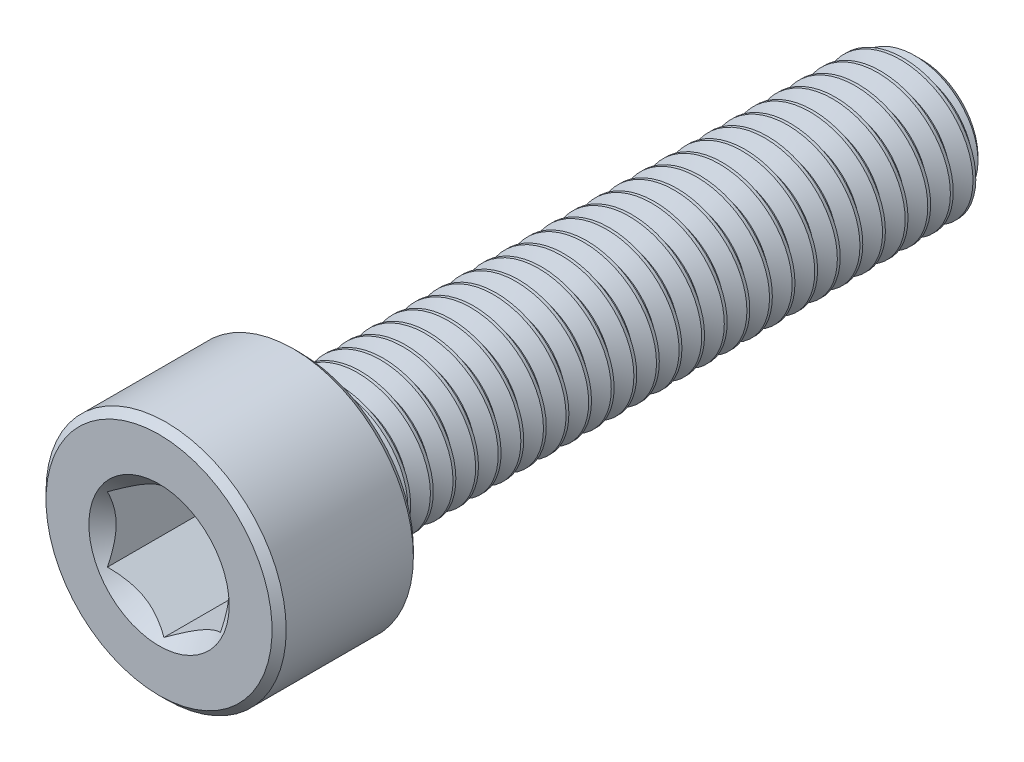
from build123d import *

# Parameters (mm, degrees)
CUT_EXTRUDE1_DEPTH     = 4
SPLIT1_SURFACE_1_BACK  = 30.555
SPLIT1_SURFACE_1_DEPTH = 61.11
SPLIT1_SURFACE_2_BACK  = 30.555
SPLIT1_SURFACE_2_DEPTH = 61.11
CUT_SWEEP1_PITCH       = 0.8


with BuildPart() as part:
    # Sketch2 → Revolve1 (revolve)
    with BuildSketch(Plane(origin=(0, 0, 0), x_dir=(0, 0, -1), z_dir=(1, 0, 0))):
        with BuildLine():
            Line((-13.5, 0), (-13.5, 4))
            Line((-13.5, 4), (-13.25, 4.25))
            Line((-13.25, 4.25), (-8.75, 4.25))
            Line((-8.75, 4.25), (-8.5, 4))
            Line((-8.5, 4), (-8.5, 2.75))
            ThreePointArc((-8.5, 2.75), (-8.426776695, 2.573223305), (-8.25, 2.5))
            Line((-8.25, 2.5), (12.980384758, 2.5))
            Line((12.980384758, 2.5), (13.5, 1.980384758))
            Line((13.5, 1.980384758), (13.5, 0))
            Line((13.5, 0), (-13.5, 0))
        make_face()
    revolve(axis=Axis((0, 0, -13.5), (0, 0, 1)))

    # Sketch3 → Cut-Extrude1 (cut)
    with BuildSketch(Plane.XY.offset(13.5)):
        Polygon((2, -1.154700538), (2, 1.154700538), (0, 2.309401077), (-2, 1.154700538), (-2, -1.154700538), (0, -2.309401077), align=None)
    extrude(amount=-CUT_EXTRUDE1_DEPTH, mode=Mode.SUBTRACT)

    # Cut-Extrude2 cone 1 section (through the dimple's axis) → Cut-Extrude2 (revolve, cut)
    with BuildSketch(Plane(origin=(0, 0, 13.5), x_dir=(0, -1, 0), z_dir=(1, 0, 0))):
        Polygon((0, 0), (2.482606158, 0), (0, 2.482606158), align=None)
    revolve(axis=Axis((0, 0, 13.5), (0, 0, -1)), mode=Mode.SUBTRACT)


with BuildPart() as body_2:
    # Split1: the piece behind the surface
    add(part.part)
    # Split1 surface: a surface, the sketch's curves swept straight by 61.11 mm
    with BuildLine(Plane(origin=(0, 0, 0), x_dir=(0, 0, -1), z_dir=(1, 0, 0)).offset(-SPLIT1_SURFACE_1_BACK), mode=Mode.PRIVATE) as split1_surface_1_path:
        Line((-8.25, -4.25), (-8.25, 4.25))
    split1_surface_1 = Shell.extrude(split1_surface_1_path.wire(), (1 * SPLIT1_SURFACE_1_DEPTH, 0 * SPLIT1_SURFACE_1_DEPTH, 0 * SPLIT1_SURFACE_1_DEPTH))
    split(bisect_by=split1_surface_1, keep=Keep.BOTTOM)

    # Cut-Sweep1: the profile of Sketch7 screwed along a right-hand helix of 28.5 turns, 8 arcs to a turn; built about Z, then put on its axis
    cut_sweep1_z = Axis((0, 0, 0), (0, 0, 1))
    cut_sweep1_corners = [(2.54330127, 0, 0.025), (2.54330127, 0, -0.725), (1.980384758, 0, -0.4), (1.980384758, 0, -0.3)]
    with BuildLine(mode=Mode.PRIVATE) as cut_sweep1_profile:
        Line(cut_sweep1_corners[0], cut_sweep1_corners[1])
        Line(cut_sweep1_corners[1], cut_sweep1_corners[2])
        Line(cut_sweep1_corners[2], cut_sweep1_corners[3])
        Line(cut_sweep1_corners[3], cut_sweep1_corners[0])
    cut_sweep1_cap = Face(cut_sweep1_profile.wire())
    cut_sweep1_turn_angles = [0, 22.5, 45, 67.5, 90, 112.5, 135, 157.5, 180, 202.5, 225, 247.5, 270, 292.5, 315, 337.5, 360]
    cut_sweep1_turn_weights = [1, 0.9238795325112867, 1, 0.9238795325112867, 1, 0.9238795325112867, 1, 0.9238795325112867, 1, 0.9238795325112867, 1, 0.9238795325112867, 1, 0.9238795325112867, 1, 0.9238795325112867, 1]
    cut_sweep1_turn_rails = [Edge.make_bspline([Vector(p[0], p[1], 0).rotate(cut_sweep1_z, cut_sweep1_turn_angles[k]) / cut_sweep1_turn_weights[k] + Vector(0, 0, p[2] + CUT_SWEEP1_PITCH * cut_sweep1_turn_angles[k] / 360) for k in range(17)], [0, 0, 0, 1, 1, 2, 2, 3, 3, 4, 4, 5, 5, 6, 6, 7, 7, 8, 8, 8], 2, cut_sweep1_turn_weights) for p in cut_sweep1_corners]
    cut_sweep1_turn_sides = [Face.make_surface_from_curves(cut_sweep1_turn_rails[p[0]], cut_sweep1_turn_rails[p[1]]) for p in [(0, 1), (1, 2), (2, 3), (3, 0)]]
    cut_sweep1_last_angles = [10080, 10102.5, 10125, 10147.5, 10170, 10192.5, 10215, 10237.5, 10260]
    cut_sweep1_last_weights = [1, 0.9238795325112867, 1, 0.9238795325112867, 1, 0.9238795325112867, 1, 0.9238795325116755, 1]
    cut_sweep1_last_rails = [Edge.make_bspline([Vector(p[0], p[1], 0).rotate(cut_sweep1_z, cut_sweep1_last_angles[k]) / cut_sweep1_last_weights[k] + Vector(0, 0, p[2] + CUT_SWEEP1_PITCH * cut_sweep1_last_angles[k] / 360) for k in range(9)], [0, 0, 0, 1, 1, 2, 2, 3, 3, 4, 4, 4], 2, cut_sweep1_last_weights) for p in cut_sweep1_corners]
    cut_sweep1_last_sides = [Face.make_surface_from_curves(cut_sweep1_last_rails[p[0]], cut_sweep1_last_rails[p[1]]) for p in [(0, 1), (1, 2), (2, 3), (3, 0)]]
    cut_sweep1 = Plane(origin=(0, 0, -13.5), x_dir=(0, 1, 0), z_dir=(0, 0, 1)) * Solid(Shell([*[p.moved(Location((0, 0, CUT_SWEEP1_PITCH * i))) for i in range(28) for p in cut_sweep1_turn_sides], *cut_sweep1_last_sides, cut_sweep1_cap, cut_sweep1_cap.rotate(cut_sweep1_z, 10260).moved(Location((0, 0, CUT_SWEEP1_PITCH * 10260 / 360)))]))
    add(cut_sweep1, mode=Mode.SUBTRACT)


with BuildPart() as part_1:
    add(part.part)

    # Split1: split by a surface, the side it looks to stays
    # Split1 surface: a surface, the sketch's curves swept straight by 61.11 mm
    with BuildLine(Plane(origin=(0, 0, 0), x_dir=(0, 0, -1), z_dir=(1, 0, 0)).offset(-SPLIT1_SURFACE_2_BACK), mode=Mode.PRIVATE) as split1_surface_2_path:
        Line((-8.25, -4.25), (-8.25, 4.25))
    split1_surface_2 = Shell.extrude(split1_surface_2_path.wire(), (1 * SPLIT1_SURFACE_2_DEPTH, 0 * SPLIT1_SURFACE_2_DEPTH, 0 * SPLIT1_SURFACE_2_DEPTH))
    split(bisect_by=split1_surface_2, keep=Keep.TOP)

    add(body_2.part)  # Revolve2 merges body 2
    # Sketch8 → Revolve2 (revolve)
    with BuildSketch(Plane(origin=(0, 0, 0), x_dir=(0, 0, -1), z_dir=(1, 0, 0)), mode=Mode.PRIVATE) as revolve2_sk:
        Polygon((-8.5, 0), (-8.5, 2.5), (-8.25, 2.5), (-6.806624327, 0), align=None)
    revolve(revolve2_sk.sketch.rotate(Axis((0, 0, 6.806624327), (0, 0, 1)), 270), axis=Axis((0, 0, 6.806624327), (0, 0, 1)))


solid = part_1.part
